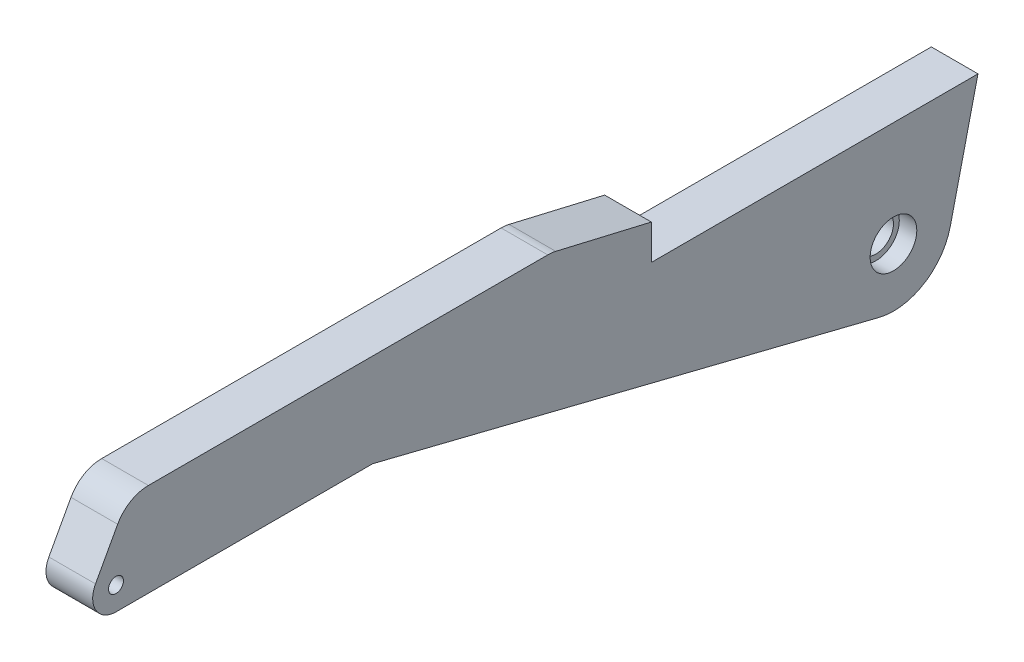
from build123d import *

# Parameters (mm, degrees)
SKETCH1_R           = 2.032
BOSS_EXTRUDE1_DEPTH = 12.7
FILLET1_R           = 9.525
SKETCH2_R           = 4.7625
CUT_EXTRUDE1_DEPTH  = 239.538490174
SKETCH4_R           = 6.35
CUT_EXTRUDE2_DEPTH  = 4.7625


with BuildPart() as part:
    # Sketch1 → Boss-Extrude1 (new body)
    with BuildSketch(Plane(origin=(0, 0, 0), x_dir=(0, 0, -1), z_dir=(1, 0, 0))):
        with BuildLine():
            Line((-5.574599012, 3.040780467), (3.157961292, 19.05))
            Line((3.157961292, 19.05), (118.608707974, 19.05))
            Line((118.608707974, 19.05), (145.69687907, 12.7))
            Line((145.69687907, 12.7), (145.69687907, 3.175))
            Line((145.69687907, 3.175), (234.59687907, 3.175))
            Line((234.59687907, 3.175), (227.048989764, -29.023191645))
            ThreePointArc((227.048989764, -29.023191645), (219.861574973, -38.951606251), (207.745061827, -40.801594665))
            Line((207.745061827, -40.801594665), (69.85, -6.35))
            Line((69.85, -6.35), (0, -6.35))
            ThreePointArc((0, -6.35), (-5.460378007, -3.241415126), (-5.574599012, 3.040780467))
        make_face()
        Circle(SKETCH1_R, mode=Mode.SUBTRACT)
    extrude(amount=BOSS_EXTRUDE1_DEPTH)

    # Fillet1
    fillet1_edges = [part.edges().sort_by_distance(p)[0] for p in [
        (6.35, 19.05, -118.608707974),
        (6.35, 19.05, -3.157961292),
    ]]
    fillet(fillet1_edges, radius=FILLET1_R)

    # Sketch2 → Cut-Extrude1 (cut, through all)
    with BuildSketch(Plane.ZY):
        with Locations((-211.592984222, -25.4)):
            Circle(SKETCH2_R)
    extrude(amount=-CUT_EXTRUDE1_DEPTH, mode=Mode.SUBTRACT)

    # Sketch4 → Cut-Extrude2 (cut)
    with BuildSketch(Plane(origin=(12.7, 0, 0), x_dir=(0, 0, -1), z_dir=(1, 0, 0))):
        with Locations((211.592984222, -25.4)):
            Circle(SKETCH4_R)
    extrude(amount=-CUT_EXTRUDE2_DEPTH, mode=Mode.SUBTRACT)


solid = part.part
